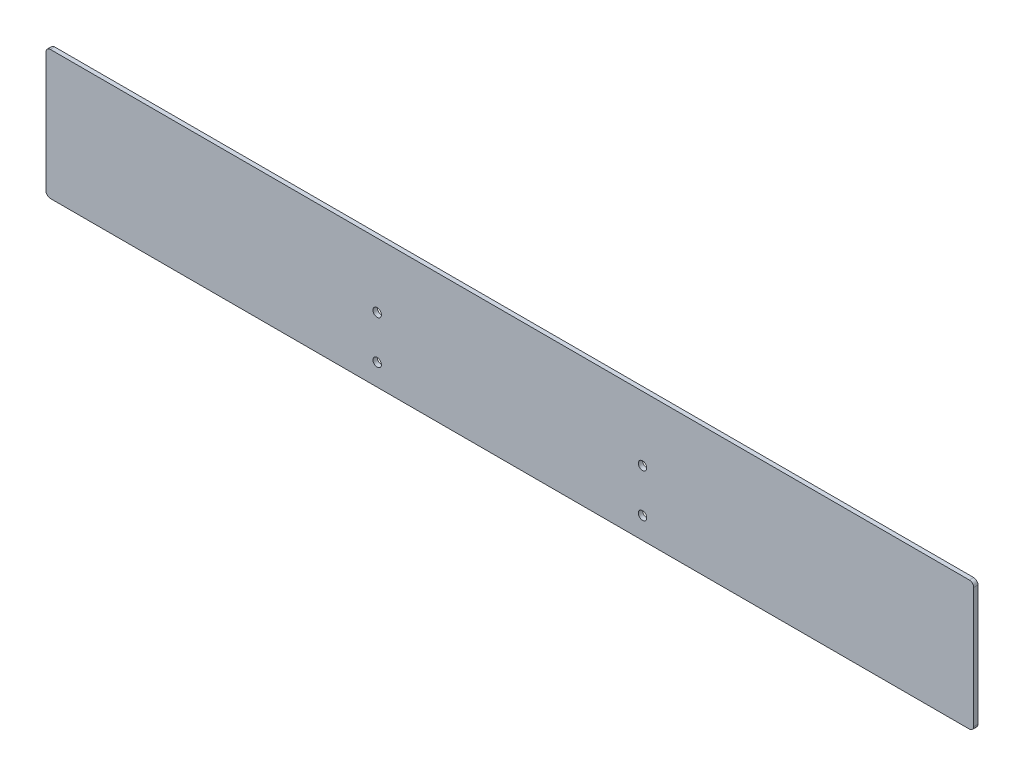
from build123d import *

# Parameters (mm, degrees)
SKETCH1_W           = 430
SKETCH1_H           = 59.85
SKETCH1_R           = 1.95
BOSS_EXTRUDE1_DEPTH = 2
FILLET1_R           = 2


with BuildPart() as part:
    # Sketch1 → Boss-Extrude1 (new body)
    with BuildSketch(Plane.XY):
        with Locations((-141.905896291, -14.371482412)):
            Rectangle(SKETCH1_W, SKETCH1_H)
        with Locations((-80.405896291, -14.296482412)):
            Circle(SKETCH1_R, mode=Mode.SUBTRACT)
        with Locations((-80.405896291, -34.296482412)):
            Circle(SKETCH1_R, mode=Mode.SUBTRACT)
        with Locations((-203.405896291, -14.296482412)):
            Circle(SKETCH1_R, mode=Mode.SUBTRACT)
        with Locations((-203.405896291, -34.296482412)):
            Circle(SKETCH1_R, mode=Mode.SUBTRACT)
    extrude(amount=BOSS_EXTRUDE1_DEPTH)

    # Fillet1
    fillet1_edges = [part.edges().sort_by_distance(p)[0] for p in [
        (73.094103709, 15.553517588, 1),
        (73.094103709, -44.296482412, 1),
        (-356.905896291, -44.296482412, 1),
        (-356.905896291, 15.553517588, 1),
    ]]
    fillet(fillet1_edges, radius=FILLET1_R)


solid = part.part
